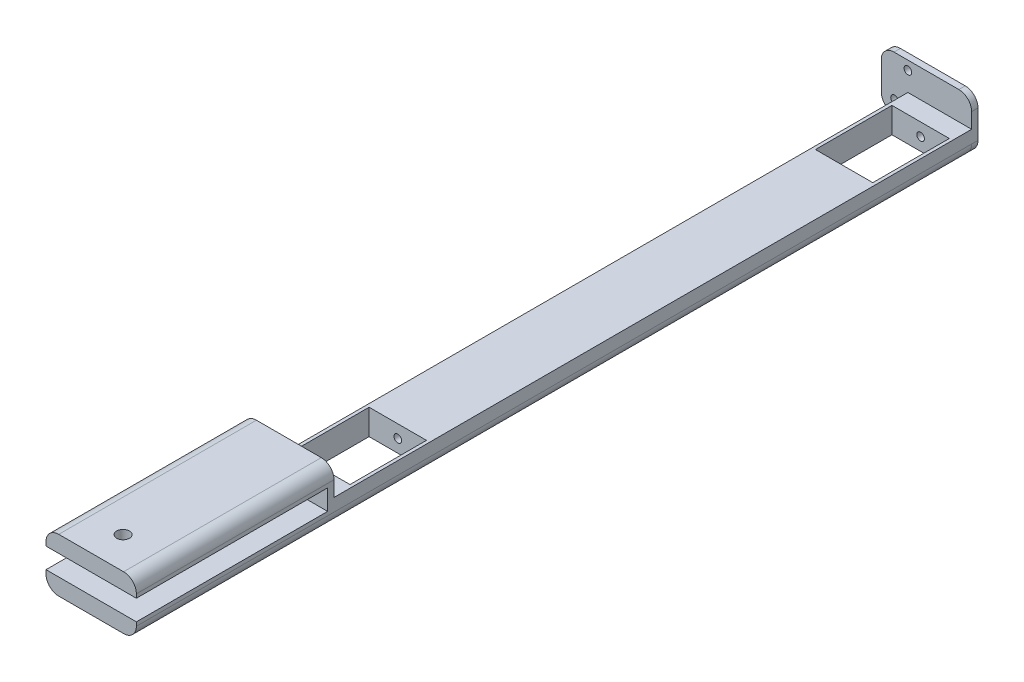
from build123d import *

# Parameters (mm, degrees)
SKETCH1_W                = 500
SKETCH1_H                = 200
BOSS_EXTRUDE1_DEPTH      = 5000
SKETCH2_W                = 450
SKETCH2_H                = 200
CUT_EXTRUDE1_DEPTH       = 600
CUT_EXTRUDE3_DEPTH       = 5000
CUT_EXTRUDE3_DEPTH_BACK  = 300
SKETCH5_R                = 30
SCALE2_SCALE             = 0.1
SKETCH13_W               = 70.87
SKETCH13_H               = 42
BOSS_EXTRUDE7_DEPTH      = 5
CUT_EXTRUDE8_DEPTH       = 509.087646868
CUT_EXTRUDE8_DEPTH_BACK  = 509.087646868
SKETCH14_R               = 3
FILLET9_R                = 10
BOSS_EXTRUDE8_DEPTH      = 150
BOSS_EXTRUDE8_DEPTH_BACK = 1
CUT_EXTRUDE9_DEPTH       = 2906.665682232
CUT_EXTRUDE9_DEPTH_BACK  = 2906.665682232
SKETCH16_R               = 5
CUT_EXTRUDE10_START      = -5
SKETCH17_R               = 3
CUT_EXTRUDE10_DEPTH      = 5
FILLET10_R               = 10
SKETCH18_R               = 3
CUT_EXTRUDE11_DEPTH      = 10


with BuildPart() as part:
    # Sketch1 → Boss-Extrude1 (new body)
    with BuildSketch(Plane.XY):
        Rectangle(SKETCH1_W, SKETCH1_H)
    extrude(amount=BOSS_EXTRUDE1_DEPTH)

    # Sketch2 → Cut-Extrude1 (cut)
    with BuildSketch(Plane.XY.offset(4850)):
        Rectangle(SKETCH2_W, SKETCH2_H)
    cut_extrude1 = extrude(amount=-CUT_EXTRUDE1_DEPTH, mode=Mode.SUBTRACT)

    # Mirror1: Cut-Extrude1 across plane
    add(cut_extrude1.mirror(Plane.XY.offset(2500)), mode=Mode.SUBTRACT)

    # Sketch5 → Cut-Extrude3 (cut, two sides: drawn at the far end of the back side and taken through both)
    with BuildSketch(Plane(origin=(0, 0, 4850), x_dir=(-1, 0, 0), z_dir=(0, 0, -1)).offset(-CUT_EXTRUDE3_DEPTH_BACK)):
        with Locations(Location((0, 0, 0), (0, 0, 180))):
            Circle(SKETCH5_R)
    extrude(amount=CUT_EXTRUDE3_DEPTH + CUT_EXTRUDE3_DEPTH_BACK, mode=Mode.SUBTRACT)


with BuildPart() as part_1:
    # Scale2: scaled about (0, 0, 2500)
    add(part.part.scale(SCALE2_SCALE).moved(Location((0, 0, 2250))))

    # Sketch13 → Boss-Extrude7 (add)
    with BuildSketch(Plane.XY.offset(2750)):
        with Locations((-10.435, 11)):
            Rectangle(SKETCH13_W, SKETCH13_H)
    boss_extrude7 = extrude(amount=BOSS_EXTRUDE7_DEPTH)

    # Sketch14 → Cut-Extrude8 (cut, two sides: drawn at the far end of the back side and taken through both)
    with BuildSketch(Plane.XY.offset(2755).offset(-CUT_EXTRUDE8_DEPTH_BACK)):
        with Locations((-35.435, 0)):
            Circle(SKETCH14_R)
        with Locations((-25, 25)):
            Circle(SKETCH14_R)
    extrude(amount=CUT_EXTRUDE8_DEPTH + CUT_EXTRUDE8_DEPTH_BACK, mode=Mode.SUBTRACT)

    # Fillet9
    # the kernel refuses this fillet: 10 mm, written as the material it takes off along each edge
    with BuildSketch(Plane(origin=(-45.87, 32, 2725), x_dir=(1, 0, 0), z_dir=(0, 0, 1)), Plane(origin=(25, 32, 2725), x_dir=(0, -1, 0), z_dir=(0, 0, 1))) as fillet9_piece_1:
        with BuildLine():
            CenterArc((FILLET9_R, -FILLET9_R), FILLET9_R, 90, 90)
            Line((0, -FILLET9_R), (0, 0))
            Line((0, 0), (FILLET9_R, 0))
        make_face()
    extrude(amount=55, mode=Mode.SUBTRACT)
    with BuildSketch(Plane(origin=(-45.87, -10, 2725), x_dir=(1, 0, 0), z_dir=(0, 0, 1))) as fillet9_piece_2:
        with BuildLine():
            CenterArc((FILLET9_R, FILLET9_R), FILLET9_R, 180, 90)
            Line((0, FILLET9_R), (0, 0))
            Line((0, 0), (FILLET9_R, 0))
        make_face()
    extrude(amount=55, mode=Mode.SUBTRACT)
    with BuildSketch(Plane(origin=(25, -10, 2780), x_dir=(0, 1, 0), z_dir=(0, 0, -1))) as fillet9_piece_3:
        with BuildLine():
            CenterArc((FILLET9_R, -FILLET9_R), FILLET9_R, 90, 90)
            Line((0, -FILLET9_R), (0, 0))
            Line((0, 0), (FILLET9_R, 0))
        make_face()
    extrude(amount=555, mode=Mode.SUBTRACT)

    # Sketch15 → Boss-Extrude8 (add, two sides: drawn at the far end of the back side and taken through both)
    with BuildSketch(Plane.XY.offset(2755).offset(-BOSS_EXTRUDE8_DEPTH_BACK)):
        with BuildLine():
            Line((-45.87, 19), (25, 19))
            Line((25, 19), (25, 22))
            ThreePointArc((25, 22), (22.071067812, 29.071067812), (15, 32))
            Line((15, 32), (-35.87, 32))
            ThreePointArc((-35.87, 32), (-42.941067812, 29.071067812), (-45.87, 22))
            Line((-45.87, 22), (-45.87, 19))
        make_face()
        with BuildLine():
            Line((25, 3), (25, 0))
            ThreePointArc((25, 0), (22.071067812, -7.071067812), (15, -10))
            Line((15, -10), (-35.87, -10))
            ThreePointArc((-35.87, -10), (-42.941067812, -7.071067812), (-45.87, 0))
            Line((-45.87, 0), (-45.87, 3))
            Line((-45.87, 3), (25, 3))
        make_face()
    extrude(amount=BOSS_EXTRUDE8_DEPTH + BOSS_EXTRUDE8_DEPTH_BACK)

    # Sketch16 → Cut-Extrude9 (cut, two sides: drawn at the far end of the back side and taken through both)
    with BuildSketch(Plane(origin=(0, 32, 0), x_dir=(1, 0, 0), z_dir=(0, 1, 0)).offset(-CUT_EXTRUDE9_DEPTH_BACK)):
        with Locations(Location((-10.435, -2880, 0), (0, 0, 180))):
            Circle(SKETCH16_R)
    extrude(amount=CUT_EXTRUDE9_DEPTH + CUT_EXTRUDE9_DEPTH_BACK, mode=Mode.SUBTRACT)

    # Mirror9: Boss-Extrude7 across plane
    add(boss_extrude7.mirror(Plane.XY.offset(2500)))

    # Sketch17 → Cut-Extrude10 (cut)
    with BuildSketch(Plane(origin=(0, 0, 2245), x_dir=(-1, 0, 0), z_dir=(0, 0, -1)).offset(CUT_EXTRUDE10_START)):
        with Locations(Location((25, 25, 0), (0, 0, 180))):
            Circle(SKETCH17_R)
        with Locations(Location((35.435, 0, 0), (0, 0, 180))):
            Circle(SKETCH17_R)
    extrude(amount=CUT_EXTRUDE10_DEPTH, mode=Mode.SUBTRACT)

    # Fillet10
    fillet10_edges = [part_1.edges().sort_by_distance(p)[0] for p in [
        (25, 32, 2247.5),
        (25, -10, 2247.5),
        (-45.87, -10, 2247.5),
        (-45.87, 32, 2247.5),
    ]]
    fillet(fillet10_edges, radius=FILLET10_R)

    # Sketch18 → Cut-Extrude11 (cut)
    with BuildSketch(Plane.XY.offset(2250)):
        Circle(SKETCH18_R)
    extrude(amount=-CUT_EXTRUDE11_DEPTH, mode=Mode.SUBTRACT)


solid = part_1.part
